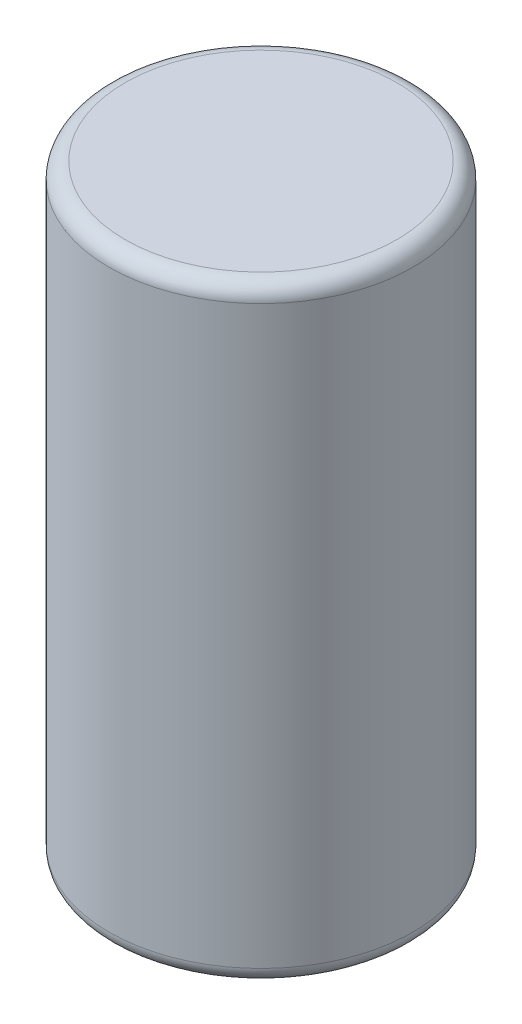
from build123d import *

# Parameters (mm, degrees)
SKETCH_1_R      = 9.5
EXTRUDE_1_DEPTH = 38
FILLET_1_R      = 1


with BuildPart() as part:
    # 草图1 → 凸台-拉伸1 (new body)
    with BuildSketch(Plane(origin=(0, 0, 0), x_dir=(1, 0, 0), z_dir=(0, 1, 0))):
        Circle(SKETCH_1_R)
    extrude(amount=EXTRUDE_1_DEPTH)

    # 圆角1
    fillet_1_edges = [part.edges().sort_by_distance(p)[0] for p in [
        (-9.5, 0, 0),
        (-9.5, 38, 0),
    ]]
    fillet(fillet_1_edges, radius=FILLET_1_R)


solid = part.part
